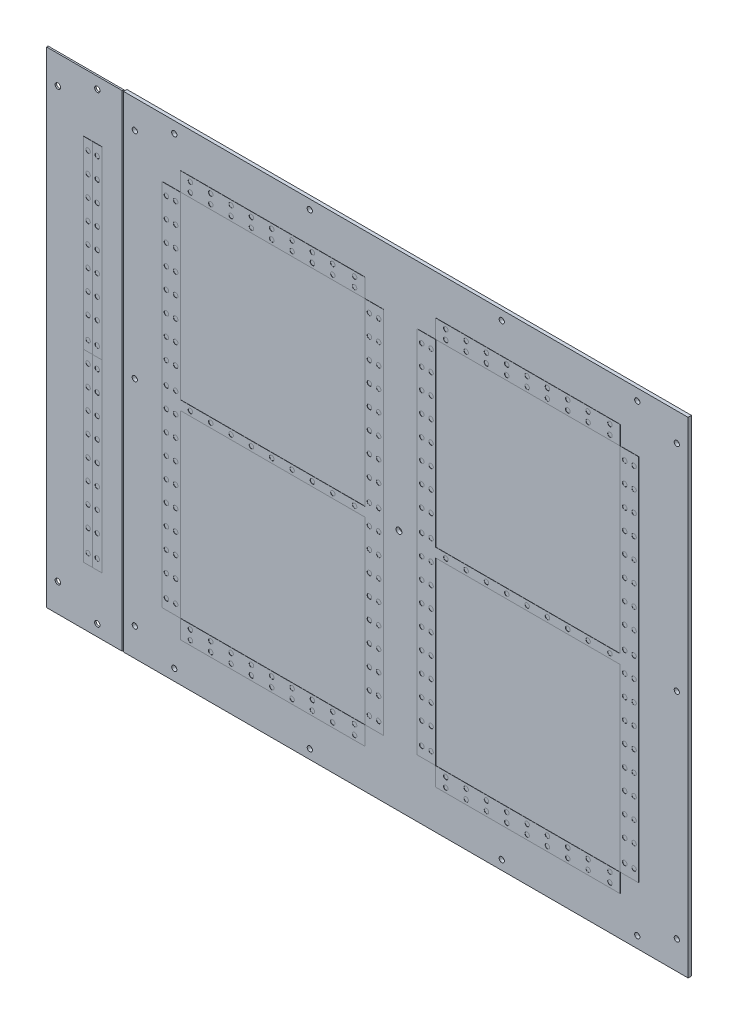
from build123d import *

# Parameters (mm, degrees)
ESBO_O4_W                        = 500
ESBO_O4_H                        = 430
FLANGE_BASE1_DEPTH               = 3
ESBO_O6_W                        = 67
ESBO_O6_H                        = 430
FLANGE_BASE2_DEPTH               = 1.4
ESBO_O9_R                        = 2.4
CORTE_EXTRUS_O2_DEPTH            = 10
RESSALTO_EXTRUS_O1_OUTLINE_W     = 8.2
RESSALTO_EXTRUS_O1_OUTLINE_H     = 163.357552272
RESSALTO_EXTRUS_O1_OUTLINE_R     = 2
RESSALTO_EXTRUS_O1_DEPTH         = 0.2
RESSALTO_EXTRUS_O1_2_OUTLINE_W   = 8.2
RESSALTO_EXTRUS_O1_2_OUTLINE_H   = 163.357552271
RESSALTO_EXTRUS_O1_2_OUTLINE_R   = 2
RESSALTO_EXTRUS_O1_2_DEPTH       = 0.2
RESSALTO_EXTRUS_O1_3_OUTLINE_W   = 8.2
RESSALTO_EXTRUS_O1_3_OUTLINE_H   = 163.357552271
RESSALTO_EXTRUS_O1_3_OUTLINE_R   = 2
RESSALTO_EXTRUS_O1_3_DEPTH       = 0.2
RESSALTO_EXTRUS_O1_4_OUTLINE_W   = 8.2
RESSALTO_EXTRUS_O1_4_OUTLINE_H   = 163.357552272
RESSALTO_EXTRUS_O1_4_OUTLINE_R   = 2
RESSALTO_EXTRUS_O1_4_DEPTH       = 0.2
RESSALTO_EXTRUS_O1_5_OUTLINE_W   = 163.357552272
RESSALTO_EXTRUS_O1_5_OUTLINE_H   = 16.4
RESSALTO_EXTRUS_O1_5_OUTLINE_R   = 2
RESSALTO_EXTRUS_O1_5_OUTLINE_W_2 = 163.357552271
RESSALTO_EXTRUS_O1_5_DEPTH       = 0.2
ESBO_O5_R                        = 2.714887618
ESBO_O5_R_2                      = 2.6
CORTE_EXTRUS_O1_DEPTH            = 10
ESBO_O13_R                       = 2.3
CORTE_EXTRUS_O3_DEPTH            = 3


with BuildPart() as part:
    # Flange-base1: sheet metal written as solids
    # Esboço4 → Flange-base1 (new body)
    with BuildSketch(Plane.XY):
        with Locations((39.157455037, 0)):
            Rectangle(ESBO_O4_W, ESBO_O4_H)
    extrude(amount=-FLANGE_BASE1_DEPTH)

    # Ressalto-extrus_o1 5 outline → Ressalto-extrus_o1 5 (add)
    # profile 1 of 6: a face of its own
    with BuildSketch(Plane.XY):
        with Locations((-78.655821477, -171.990181002)):
            Rectangle(RESSALTO_EXTRUS_O1_5_OUTLINE_W, RESSALTO_EXTRUS_O1_5_OUTLINE_H)
        with Locations((-151.334597613, -176.090181002)):
            Circle(RESSALTO_EXTRUS_O1_5_OUTLINE_R, mode=Mode.SUBTRACT)
        with Locations((-151.334597613, -167.890181002)):
            Circle(RESSALTO_EXTRUS_O1_5_OUTLINE_R, mode=Mode.SUBTRACT)
        with Locations((-133.334597613, -176.090181002)):
            Circle(RESSALTO_EXTRUS_O1_5_OUTLINE_R, mode=Mode.SUBTRACT)
        with Locations((-133.334597613, -167.890181002)):
            Circle(RESSALTO_EXTRUS_O1_5_OUTLINE_R, mode=Mode.SUBTRACT)
        with Locations((-115.334597613, -176.090181002)):
            Circle(RESSALTO_EXTRUS_O1_5_OUTLINE_R, mode=Mode.SUBTRACT)
        with Locations((-115.334597613, -167.890181002)):
            Circle(RESSALTO_EXTRUS_O1_5_OUTLINE_R, mode=Mode.SUBTRACT)
        with Locations((-97.334597613, -176.090181002)):
            Circle(RESSALTO_EXTRUS_O1_5_OUTLINE_R, mode=Mode.SUBTRACT)
        with Locations((-79.334597613, -176.090181002)):
            Circle(RESSALTO_EXTRUS_O1_5_OUTLINE_R, mode=Mode.SUBTRACT)
        with Locations((-97.334597613, -167.890181002)):
            Circle(RESSALTO_EXTRUS_O1_5_OUTLINE_R, mode=Mode.SUBTRACT)
        with Locations((-79.334597613, -167.890181002)):
            Circle(RESSALTO_EXTRUS_O1_5_OUTLINE_R, mode=Mode.SUBTRACT)
        with Locations((-61.334597613, -176.090181002)):
            Circle(RESSALTO_EXTRUS_O1_5_OUTLINE_R, mode=Mode.SUBTRACT)
        with Locations((-61.334597613, -167.890181002)):
            Circle(RESSALTO_EXTRUS_O1_5_OUTLINE_R, mode=Mode.SUBTRACT)
        with Locations((-43.334597613, -176.090181002)):
            Circle(RESSALTO_EXTRUS_O1_5_OUTLINE_R, mode=Mode.SUBTRACT)
        with Locations((-25.334597613, -176.090181002)):
            Circle(RESSALTO_EXTRUS_O1_5_OUTLINE_R, mode=Mode.SUBTRACT)
        with Locations((-43.334597613, -167.890181002)):
            Circle(RESSALTO_EXTRUS_O1_5_OUTLINE_R, mode=Mode.SUBTRACT)
        with Locations((-25.334597613, -167.890181002)):
            Circle(RESSALTO_EXTRUS_O1_5_OUTLINE_R, mode=Mode.SUBTRACT)
        with Locations((-5.977045341, -176.090181002)):
            Circle(RESSALTO_EXTRUS_O1_5_OUTLINE_R, mode=Mode.SUBTRACT)
        with Locations((-5.977045341, -167.890181002)):
            Circle(RESSALTO_EXTRUS_O1_5_OUTLINE_R, mode=Mode.SUBTRACT)
    # profile 2 of 6: a face of its own
    with BuildSketch(Plane.XY):
        with Locations((147.501730795, -171.990181002)):
            Rectangle(RESSALTO_EXTRUS_O1_5_OUTLINE_W_2, RESSALTO_EXTRUS_O1_5_OUTLINE_H)
        with Locations((74.822954659, -176.090181002)):
            Circle(RESSALTO_EXTRUS_O1_5_OUTLINE_R, mode=Mode.SUBTRACT)
        with Locations((74.822954659, -167.890181002)):
            Circle(RESSALTO_EXTRUS_O1_5_OUTLINE_R, mode=Mode.SUBTRACT)
        with Locations((92.822954659, -176.090181002)):
            Circle(RESSALTO_EXTRUS_O1_5_OUTLINE_R, mode=Mode.SUBTRACT)
        with Locations((110.822954659, -176.090181002)):
            Circle(RESSALTO_EXTRUS_O1_5_OUTLINE_R, mode=Mode.SUBTRACT)
        with Locations((92.822954659, -167.890181002)):
            Circle(RESSALTO_EXTRUS_O1_5_OUTLINE_R, mode=Mode.SUBTRACT)
        with Locations((110.822954659, -167.890181002)):
            Circle(RESSALTO_EXTRUS_O1_5_OUTLINE_R, mode=Mode.SUBTRACT)
        with Locations((128.822954659, -176.090181002)):
            Circle(RESSALTO_EXTRUS_O1_5_OUTLINE_R, mode=Mode.SUBTRACT)
        with Locations((128.822954659, -167.890181002)):
            Circle(RESSALTO_EXTRUS_O1_5_OUTLINE_R, mode=Mode.SUBTRACT)
        with Locations((146.822954659, -176.090181002)):
            Circle(RESSALTO_EXTRUS_O1_5_OUTLINE_R, mode=Mode.SUBTRACT)
        with Locations((164.822954659, -176.090181002)):
            Circle(RESSALTO_EXTRUS_O1_5_OUTLINE_R, mode=Mode.SUBTRACT)
        with Locations((146.822954659, -167.890181002)):
            Circle(RESSALTO_EXTRUS_O1_5_OUTLINE_R, mode=Mode.SUBTRACT)
        with Locations((164.822954659, -167.890181002)):
            Circle(RESSALTO_EXTRUS_O1_5_OUTLINE_R, mode=Mode.SUBTRACT)
        with Locations((182.822954659, -176.090181002)):
            Circle(RESSALTO_EXTRUS_O1_5_OUTLINE_R, mode=Mode.SUBTRACT)
        with Locations((182.822954659, -167.890181002)):
            Circle(RESSALTO_EXTRUS_O1_5_OUTLINE_R, mode=Mode.SUBTRACT)
        with Locations((200.822954659, -176.090181002)):
            Circle(RESSALTO_EXTRUS_O1_5_OUTLINE_R, mode=Mode.SUBTRACT)
        with Locations((200.822954659, -167.890181002)):
            Circle(RESSALTO_EXTRUS_O1_5_OUTLINE_R, mode=Mode.SUBTRACT)
        with Locations((220.18050693, -176.090181002)):
            Circle(RESSALTO_EXTRUS_O1_5_OUTLINE_R, mode=Mode.SUBTRACT)
        with Locations((220.18050693, -167.890181002)):
            Circle(RESSALTO_EXTRUS_O1_5_OUTLINE_R, mode=Mode.SUBTRACT)
    # profile 3 of 6: a face of its own
    with BuildSketch(Plane.XY):
        Polygon((3.022954659, 3.787927443), (-160.334597613, 3.787927443), (-160.334597613, 163.045479714), (-176.734597613, 163.045479714), (-176.734597613, -163.669624829), (-160.334597613, -163.669624829), (-160.334597613, -4.412072557), (3.022954659, -4.412072557), (3.022954659, -163.669624829), (19.422954659, -163.669624829), (19.422954659, 163.045479714), (3.022954659, 163.045479714), align=None)
        with Locations((-172.634597613, -154.669624829)):
            Circle(RESSALTO_EXTRUS_O1_5_OUTLINE_R, mode=Mode.SUBTRACT)
        with Locations((-164.434597613, -154.669624829)):
            Circle(RESSALTO_EXTRUS_O1_5_OUTLINE_R, mode=Mode.SUBTRACT)
        with Locations((-172.634597613, -135.312072557)):
            Circle(RESSALTO_EXTRUS_O1_5_OUTLINE_R, mode=Mode.SUBTRACT)
        with Locations((-164.434597613, -135.312072557)):
            Circle(RESSALTO_EXTRUS_O1_5_OUTLINE_R, mode=Mode.SUBTRACT)
        with Locations((-172.634597613, -117.312072557)):
            Circle(RESSALTO_EXTRUS_O1_5_OUTLINE_R, mode=Mode.SUBTRACT)
        with Locations((-164.434597613, -117.312072557)):
            Circle(RESSALTO_EXTRUS_O1_5_OUTLINE_R, mode=Mode.SUBTRACT)
        with Locations((-172.634597613, -99.312072557)):
            Circle(RESSALTO_EXTRUS_O1_5_OUTLINE_R, mode=Mode.SUBTRACT)
        with Locations((-164.434597613, -99.312072557)):
            Circle(RESSALTO_EXTRUS_O1_5_OUTLINE_R, mode=Mode.SUBTRACT)
        with Locations((7.122954659, -154.669624829)):
            Circle(RESSALTO_EXTRUS_O1_5_OUTLINE_R, mode=Mode.SUBTRACT)
        with Locations((7.122954659, -135.312072557)):
            Circle(RESSALTO_EXTRUS_O1_5_OUTLINE_R, mode=Mode.SUBTRACT)
        with Locations((15.322954659, -154.669624829)):
            Circle(RESSALTO_EXTRUS_O1_5_OUTLINE_R, mode=Mode.SUBTRACT)
        with Locations((15.322954659, -135.312072557)):
            Circle(RESSALTO_EXTRUS_O1_5_OUTLINE_R, mode=Mode.SUBTRACT)
        with Locations((7.122954659, -117.312072557)):
            Circle(RESSALTO_EXTRUS_O1_5_OUTLINE_R, mode=Mode.SUBTRACT)
        with Locations((15.322954659, -117.312072557)):
            Circle(RESSALTO_EXTRUS_O1_5_OUTLINE_R, mode=Mode.SUBTRACT)
        with Locations((7.122954659, -99.312072557)):
            Circle(RESSALTO_EXTRUS_O1_5_OUTLINE_R, mode=Mode.SUBTRACT)
        with Locations((15.322954659, -99.312072557)):
            Circle(RESSALTO_EXTRUS_O1_5_OUTLINE_R, mode=Mode.SUBTRACT)
        with Locations((-172.634597613, -81.312072557)):
            Circle(RESSALTO_EXTRUS_O1_5_OUTLINE_R, mode=Mode.SUBTRACT)
        with Locations((-164.434597613, -81.312072557)):
            Circle(RESSALTO_EXTRUS_O1_5_OUTLINE_R, mode=Mode.SUBTRACT)
        with Locations((-172.634597613, -63.312072557)):
            Circle(RESSALTO_EXTRUS_O1_5_OUTLINE_R, mode=Mode.SUBTRACT)
        with Locations((-164.434597613, -63.312072557)):
            Circle(RESSALTO_EXTRUS_O1_5_OUTLINE_R, mode=Mode.SUBTRACT)
        with Locations((-172.634597613, -45.312072557)):
            Circle(RESSALTO_EXTRUS_O1_5_OUTLINE_R, mode=Mode.SUBTRACT)
        with Locations((-164.434597613, -45.312072557)):
            Circle(RESSALTO_EXTRUS_O1_5_OUTLINE_R, mode=Mode.SUBTRACT)
        with Locations((-172.634597613, -27.312072557)):
            Circle(RESSALTO_EXTRUS_O1_5_OUTLINE_R, mode=Mode.SUBTRACT)
        with Locations((-164.434597613, -27.312072557)):
            Circle(RESSALTO_EXTRUS_O1_5_OUTLINE_R, mode=Mode.SUBTRACT)
        with Locations((-172.634597613, -9.312072557)):
            Circle(RESSALTO_EXTRUS_O1_5_OUTLINE_R, mode=Mode.SUBTRACT)
        with Locations((-164.434597613, -9.312072557)):
            Circle(RESSALTO_EXTRUS_O1_5_OUTLINE_R, mode=Mode.SUBTRACT)
        with Locations((-151.334597613, -0.312072557)):
            Circle(RESSALTO_EXTRUS_O1_5_OUTLINE_R, mode=Mode.SUBTRACT)
        with Locations((-133.334597613, -0.312072557)):
            Circle(RESSALTO_EXTRUS_O1_5_OUTLINE_R, mode=Mode.SUBTRACT)
        with Locations((-115.334597613, -0.312072557)):
            Circle(RESSALTO_EXTRUS_O1_5_OUTLINE_R, mode=Mode.SUBTRACT)
        with Locations((-97.334597613, -0.312072557)):
            Circle(RESSALTO_EXTRUS_O1_5_OUTLINE_R, mode=Mode.SUBTRACT)
        with Locations((-79.334597613, -0.312072557)):
            Circle(RESSALTO_EXTRUS_O1_5_OUTLINE_R, mode=Mode.SUBTRACT)
        with Locations((7.122954659, -81.312072557)):
            Circle(RESSALTO_EXTRUS_O1_5_OUTLINE_R, mode=Mode.SUBTRACT)
        with Locations((15.322954659, -81.312072557)):
            Circle(RESSALTO_EXTRUS_O1_5_OUTLINE_R, mode=Mode.SUBTRACT)
        with Locations((7.122954659, -63.312072557)):
            Circle(RESSALTO_EXTRUS_O1_5_OUTLINE_R, mode=Mode.SUBTRACT)
        with Locations((7.122954659, -45.312072557)):
            Circle(RESSALTO_EXTRUS_O1_5_OUTLINE_R, mode=Mode.SUBTRACT)
        with Locations((15.322954659, -63.312072557)):
            Circle(RESSALTO_EXTRUS_O1_5_OUTLINE_R, mode=Mode.SUBTRACT)
        with Locations((15.322954659, -45.312072557)):
            Circle(RESSALTO_EXTRUS_O1_5_OUTLINE_R, mode=Mode.SUBTRACT)
        with Locations((-61.334597613, -0.312072557)):
            Circle(RESSALTO_EXTRUS_O1_5_OUTLINE_R, mode=Mode.SUBTRACT)
        with Locations((-43.334597613, -0.312072557)):
            Circle(RESSALTO_EXTRUS_O1_5_OUTLINE_R, mode=Mode.SUBTRACT)
        with Locations((-25.334597613, -0.312072557)):
            Circle(RESSALTO_EXTRUS_O1_5_OUTLINE_R, mode=Mode.SUBTRACT)
        with Locations((7.122954659, -27.312072557)):
            Circle(RESSALTO_EXTRUS_O1_5_OUTLINE_R, mode=Mode.SUBTRACT)
        with Locations((15.322954659, -27.312072557)):
            Circle(RESSALTO_EXTRUS_O1_5_OUTLINE_R, mode=Mode.SUBTRACT)
        with Locations((-5.977045341, -0.312072557)):
            Circle(RESSALTO_EXTRUS_O1_5_OUTLINE_R, mode=Mode.SUBTRACT)
        with Locations((7.122954659, -9.312072557)):
            Circle(RESSALTO_EXTRUS_O1_5_OUTLINE_R, mode=Mode.SUBTRACT)
        with Locations((15.322954659, -9.312072557)):
            Circle(RESSALTO_EXTRUS_O1_5_OUTLINE_R, mode=Mode.SUBTRACT)
        with Locations((-172.634597613, 8.687927443)):
            Circle(RESSALTO_EXTRUS_O1_5_OUTLINE_R, mode=Mode.SUBTRACT)
        with Locations((-164.434597613, 8.687927443)):
            Circle(RESSALTO_EXTRUS_O1_5_OUTLINE_R, mode=Mode.SUBTRACT)
        with Locations((-172.634597613, 28.045479714)):
            Circle(RESSALTO_EXTRUS_O1_5_OUTLINE_R, mode=Mode.SUBTRACT)
        with Locations((-164.434597613, 28.045479714)):
            Circle(RESSALTO_EXTRUS_O1_5_OUTLINE_R, mode=Mode.SUBTRACT)
        with Locations((-172.634597613, 46.045479714)):
            Circle(RESSALTO_EXTRUS_O1_5_OUTLINE_R, mode=Mode.SUBTRACT)
        with Locations((-164.434597613, 46.045479714)):
            Circle(RESSALTO_EXTRUS_O1_5_OUTLINE_R, mode=Mode.SUBTRACT)
        with Locations((-172.634597613, 64.045479714)):
            Circle(RESSALTO_EXTRUS_O1_5_OUTLINE_R, mode=Mode.SUBTRACT)
        with Locations((-164.434597613, 64.045479714)):
            Circle(RESSALTO_EXTRUS_O1_5_OUTLINE_R, mode=Mode.SUBTRACT)
        with Locations((-172.634597613, 82.045479714)):
            Circle(RESSALTO_EXTRUS_O1_5_OUTLINE_R, mode=Mode.SUBTRACT)
        with Locations((-164.434597613, 82.045479714)):
            Circle(RESSALTO_EXTRUS_O1_5_OUTLINE_R, mode=Mode.SUBTRACT)
        with Locations((7.122954659, 8.687927443)):
            Circle(RESSALTO_EXTRUS_O1_5_OUTLINE_R, mode=Mode.SUBTRACT)
        with Locations((15.322954659, 8.687927443)):
            Circle(RESSALTO_EXTRUS_O1_5_OUTLINE_R, mode=Mode.SUBTRACT)
        with Locations((7.122954659, 28.045479714)):
            Circle(RESSALTO_EXTRUS_O1_5_OUTLINE_R, mode=Mode.SUBTRACT)
        with Locations((15.322954659, 28.045479714)):
            Circle(RESSALTO_EXTRUS_O1_5_OUTLINE_R, mode=Mode.SUBTRACT)
        with Locations((7.122954659, 46.045479714)):
            Circle(RESSALTO_EXTRUS_O1_5_OUTLINE_R, mode=Mode.SUBTRACT)
        with Locations((7.122954659, 64.045479714)):
            Circle(RESSALTO_EXTRUS_O1_5_OUTLINE_R, mode=Mode.SUBTRACT)
        with Locations((15.322954659, 46.045479714)):
            Circle(RESSALTO_EXTRUS_O1_5_OUTLINE_R, mode=Mode.SUBTRACT)
        with Locations((15.322954659, 64.045479714)):
            Circle(RESSALTO_EXTRUS_O1_5_OUTLINE_R, mode=Mode.SUBTRACT)
        with Locations((7.122954659, 82.045479714)):
            Circle(RESSALTO_EXTRUS_O1_5_OUTLINE_R, mode=Mode.SUBTRACT)
        with Locations((15.322954659, 82.045479714)):
            Circle(RESSALTO_EXTRUS_O1_5_OUTLINE_R, mode=Mode.SUBTRACT)
        with Locations((-172.634597613, 100.045479714)):
            Circle(RESSALTO_EXTRUS_O1_5_OUTLINE_R, mode=Mode.SUBTRACT)
        with Locations((-164.434597613, 100.045479714)):
            Circle(RESSALTO_EXTRUS_O1_5_OUTLINE_R, mode=Mode.SUBTRACT)
        with Locations((-172.634597613, 118.045479714)):
            Circle(RESSALTO_EXTRUS_O1_5_OUTLINE_R, mode=Mode.SUBTRACT)
        with Locations((-164.434597613, 118.045479714)):
            Circle(RESSALTO_EXTRUS_O1_5_OUTLINE_R, mode=Mode.SUBTRACT)
        with Locations((-172.634597613, 136.045479714)):
            Circle(RESSALTO_EXTRUS_O1_5_OUTLINE_R, mode=Mode.SUBTRACT)
        with Locations((-164.434597613, 136.045479714)):
            Circle(RESSALTO_EXTRUS_O1_5_OUTLINE_R, mode=Mode.SUBTRACT)
        with Locations((-172.634597613, 154.045479714)):
            Circle(RESSALTO_EXTRUS_O1_5_OUTLINE_R, mode=Mode.SUBTRACT)
        with Locations((-164.434597613, 154.045479714)):
            Circle(RESSALTO_EXTRUS_O1_5_OUTLINE_R, mode=Mode.SUBTRACT)
        with Locations((7.122954659, 100.045479714)):
            Circle(RESSALTO_EXTRUS_O1_5_OUTLINE_R, mode=Mode.SUBTRACT)
        with Locations((15.322954659, 100.045479714)):
            Circle(RESSALTO_EXTRUS_O1_5_OUTLINE_R, mode=Mode.SUBTRACT)
        with Locations((7.122954659, 118.045479714)):
            Circle(RESSALTO_EXTRUS_O1_5_OUTLINE_R, mode=Mode.SUBTRACT)
        with Locations((15.322954659, 118.045479714)):
            Circle(RESSALTO_EXTRUS_O1_5_OUTLINE_R, mode=Mode.SUBTRACT)
        with Locations((7.122954659, 136.045479714)):
            Circle(RESSALTO_EXTRUS_O1_5_OUTLINE_R, mode=Mode.SUBTRACT)
        with Locations((7.122954659, 154.045479714)):
            Circle(RESSALTO_EXTRUS_O1_5_OUTLINE_R, mode=Mode.SUBTRACT)
        with Locations((15.322954659, 136.045479714)):
            Circle(RESSALTO_EXTRUS_O1_5_OUTLINE_R, mode=Mode.SUBTRACT)
        with Locations((15.322954659, 154.045479714)):
            Circle(RESSALTO_EXTRUS_O1_5_OUTLINE_R, mode=Mode.SUBTRACT)
    # profile 4 of 6: a face of its own
    with BuildSketch(Plane.XY):
        Polygon((229.18050693, 3.787927443), (65.822954659, 3.787927443), (65.822954659, 163.045479714), (49.422954659, 163.045479714), (49.422954659, -163.669624829), (65.822954659, -163.669624829), (65.822954659, -4.412072557), (229.18050693, -4.412072557), (229.18050693, -163.669624829), (245.58050693, -163.669624829), (245.58050693, 163.045479714), (229.18050693, 163.045479714), align=None)
        with Locations((53.522954659, -154.669624829)):
            Circle(RESSALTO_EXTRUS_O1_5_OUTLINE_R, mode=Mode.SUBTRACT)
        with Locations((53.522954659, -135.312072557)):
            Circle(RESSALTO_EXTRUS_O1_5_OUTLINE_R, mode=Mode.SUBTRACT)
        with Locations((61.722954659, -154.669624829)):
            Circle(RESSALTO_EXTRUS_O1_5_OUTLINE_R, mode=Mode.SUBTRACT)
        with Locations((61.722954659, -135.312072557)):
            Circle(RESSALTO_EXTRUS_O1_5_OUTLINE_R, mode=Mode.SUBTRACT)
        with Locations((53.522954659, -117.312072557)):
            Circle(RESSALTO_EXTRUS_O1_5_OUTLINE_R, mode=Mode.SUBTRACT)
        with Locations((61.722954659, -117.312072557)):
            Circle(RESSALTO_EXTRUS_O1_5_OUTLINE_R, mode=Mode.SUBTRACT)
        with Locations((53.522954659, -99.312072557)):
            Circle(RESSALTO_EXTRUS_O1_5_OUTLINE_R, mode=Mode.SUBTRACT)
        with Locations((61.722954659, -99.312072557)):
            Circle(RESSALTO_EXTRUS_O1_5_OUTLINE_R, mode=Mode.SUBTRACT)
        with Locations((233.28050693, -154.669624829)):
            Circle(RESSALTO_EXTRUS_O1_5_OUTLINE_R, mode=Mode.SUBTRACT)
        with Locations((241.48050693, -154.669624829)):
            Circle(RESSALTO_EXTRUS_O1_5_OUTLINE_R, mode=Mode.SUBTRACT)
        with Locations((233.28050693, -135.312072557)):
            Circle(RESSALTO_EXTRUS_O1_5_OUTLINE_R, mode=Mode.SUBTRACT)
        with Locations((241.48050693, -135.312072557)):
            Circle(RESSALTO_EXTRUS_O1_5_OUTLINE_R, mode=Mode.SUBTRACT)
        with Locations((233.28050693, -117.312072557)):
            Circle(RESSALTO_EXTRUS_O1_5_OUTLINE_R, mode=Mode.SUBTRACT)
        with Locations((241.48050693, -117.312072557)):
            Circle(RESSALTO_EXTRUS_O1_5_OUTLINE_R, mode=Mode.SUBTRACT)
        with Locations((233.28050693, -99.312072557)):
            Circle(RESSALTO_EXTRUS_O1_5_OUTLINE_R, mode=Mode.SUBTRACT)
        with Locations((241.48050693, -99.312072557)):
            Circle(RESSALTO_EXTRUS_O1_5_OUTLINE_R, mode=Mode.SUBTRACT)
        with Locations((53.522954659, -81.312072557)):
            Circle(RESSALTO_EXTRUS_O1_5_OUTLINE_R, mode=Mode.SUBTRACT)
        with Locations((61.722954659, -81.312072557)):
            Circle(RESSALTO_EXTRUS_O1_5_OUTLINE_R, mode=Mode.SUBTRACT)
        with Locations((53.522954659, -63.312072557)):
            Circle(RESSALTO_EXTRUS_O1_5_OUTLINE_R, mode=Mode.SUBTRACT)
        with Locations((53.522954659, -45.312072557)):
            Circle(RESSALTO_EXTRUS_O1_5_OUTLINE_R, mode=Mode.SUBTRACT)
        with Locations((61.722954659, -63.312072557)):
            Circle(RESSALTO_EXTRUS_O1_5_OUTLINE_R, mode=Mode.SUBTRACT)
        with Locations((61.722954659, -45.312072557)):
            Circle(RESSALTO_EXTRUS_O1_5_OUTLINE_R, mode=Mode.SUBTRACT)
        with Locations((53.522954659, -27.312072557)):
            Circle(RESSALTO_EXTRUS_O1_5_OUTLINE_R, mode=Mode.SUBTRACT)
        with Locations((61.722954659, -27.312072557)):
            Circle(RESSALTO_EXTRUS_O1_5_OUTLINE_R, mode=Mode.SUBTRACT)
        with Locations((53.522954659, -9.312072557)):
            Circle(RESSALTO_EXTRUS_O1_5_OUTLINE_R, mode=Mode.SUBTRACT)
        with Locations((61.722954659, -9.312072557)):
            Circle(RESSALTO_EXTRUS_O1_5_OUTLINE_R, mode=Mode.SUBTRACT)
        with Locations((74.822954659, -0.312072557)):
            Circle(RESSALTO_EXTRUS_O1_5_OUTLINE_R, mode=Mode.SUBTRACT)
        with Locations((92.822954659, -0.312072557)):
            Circle(RESSALTO_EXTRUS_O1_5_OUTLINE_R, mode=Mode.SUBTRACT)
        with Locations((110.822954659, -0.312072557)):
            Circle(RESSALTO_EXTRUS_O1_5_OUTLINE_R, mode=Mode.SUBTRACT)
        with Locations((128.822954659, -0.312072557)):
            Circle(RESSALTO_EXTRUS_O1_5_OUTLINE_R, mode=Mode.SUBTRACT)
        with Locations((233.28050693, -81.312072557)):
            Circle(RESSALTO_EXTRUS_O1_5_OUTLINE_R, mode=Mode.SUBTRACT)
        with Locations((241.48050693, -81.312072557)):
            Circle(RESSALTO_EXTRUS_O1_5_OUTLINE_R, mode=Mode.SUBTRACT)
        with Locations((233.28050693, -63.312072557)):
            Circle(RESSALTO_EXTRUS_O1_5_OUTLINE_R, mode=Mode.SUBTRACT)
        with Locations((241.48050693, -63.312072557)):
            Circle(RESSALTO_EXTRUS_O1_5_OUTLINE_R, mode=Mode.SUBTRACT)
        with Locations((233.28050693, -45.312072557)):
            Circle(RESSALTO_EXTRUS_O1_5_OUTLINE_R, mode=Mode.SUBTRACT)
        with Locations((241.48050693, -45.312072557)):
            Circle(RESSALTO_EXTRUS_O1_5_OUTLINE_R, mode=Mode.SUBTRACT)
        with Locations((146.822954659, -0.312072557)):
            Circle(RESSALTO_EXTRUS_O1_5_OUTLINE_R, mode=Mode.SUBTRACT)
        with Locations((164.822954659, -0.312072557)):
            Circle(RESSALTO_EXTRUS_O1_5_OUTLINE_R, mode=Mode.SUBTRACT)
        with Locations((182.822954659, -0.312072557)):
            Circle(RESSALTO_EXTRUS_O1_5_OUTLINE_R, mode=Mode.SUBTRACT)
        with Locations((233.28050693, -27.312072557)):
            Circle(RESSALTO_EXTRUS_O1_5_OUTLINE_R, mode=Mode.SUBTRACT)
        with Locations((241.48050693, -27.312072557)):
            Circle(RESSALTO_EXTRUS_O1_5_OUTLINE_R, mode=Mode.SUBTRACT)
        with Locations((200.822954659, -0.312072557)):
            Circle(RESSALTO_EXTRUS_O1_5_OUTLINE_R, mode=Mode.SUBTRACT)
        with Locations((220.18050693, -0.312072557)):
            Circle(RESSALTO_EXTRUS_O1_5_OUTLINE_R, mode=Mode.SUBTRACT)
        with Locations((233.28050693, -9.312072557)):
            Circle(RESSALTO_EXTRUS_O1_5_OUTLINE_R, mode=Mode.SUBTRACT)
        with Locations((241.48050693, -9.312072557)):
            Circle(RESSALTO_EXTRUS_O1_5_OUTLINE_R, mode=Mode.SUBTRACT)
        with Locations((53.522954659, 8.687927443)):
            Circle(RESSALTO_EXTRUS_O1_5_OUTLINE_R, mode=Mode.SUBTRACT)
        with Locations((61.722954659, 8.687927443)):
            Circle(RESSALTO_EXTRUS_O1_5_OUTLINE_R, mode=Mode.SUBTRACT)
        with Locations((53.522954659, 28.045479714)):
            Circle(RESSALTO_EXTRUS_O1_5_OUTLINE_R, mode=Mode.SUBTRACT)
        with Locations((61.722954659, 28.045479714)):
            Circle(RESSALTO_EXTRUS_O1_5_OUTLINE_R, mode=Mode.SUBTRACT)
        with Locations((53.522954659, 46.045479714)):
            Circle(RESSALTO_EXTRUS_O1_5_OUTLINE_R, mode=Mode.SUBTRACT)
        with Locations((53.522954659, 64.045479714)):
            Circle(RESSALTO_EXTRUS_O1_5_OUTLINE_R, mode=Mode.SUBTRACT)
        with Locations((61.722954659, 46.045479714)):
            Circle(RESSALTO_EXTRUS_O1_5_OUTLINE_R, mode=Mode.SUBTRACT)
        with Locations((61.722954659, 64.045479714)):
            Circle(RESSALTO_EXTRUS_O1_5_OUTLINE_R, mode=Mode.SUBTRACT)
        with Locations((53.522954659, 82.045479714)):
            Circle(RESSALTO_EXTRUS_O1_5_OUTLINE_R, mode=Mode.SUBTRACT)
        with Locations((61.722954659, 82.045479714)):
            Circle(RESSALTO_EXTRUS_O1_5_OUTLINE_R, mode=Mode.SUBTRACT)
        with Locations((233.28050693, 8.687927443)):
            Circle(RESSALTO_EXTRUS_O1_5_OUTLINE_R, mode=Mode.SUBTRACT)
        with Locations((241.48050693, 8.687927443)):
            Circle(RESSALTO_EXTRUS_O1_5_OUTLINE_R, mode=Mode.SUBTRACT)
        with Locations((233.28050693, 28.045479714)):
            Circle(RESSALTO_EXTRUS_O1_5_OUTLINE_R, mode=Mode.SUBTRACT)
        with Locations((241.48050693, 28.045479714)):
            Circle(RESSALTO_EXTRUS_O1_5_OUTLINE_R, mode=Mode.SUBTRACT)
        with Locations((233.28050693, 46.045479714)):
            Circle(RESSALTO_EXTRUS_O1_5_OUTLINE_R, mode=Mode.SUBTRACT)
        with Locations((241.48050693, 46.045479714)):
            Circle(RESSALTO_EXTRUS_O1_5_OUTLINE_R, mode=Mode.SUBTRACT)
        with Locations((233.28050693, 64.045479714)):
            Circle(RESSALTO_EXTRUS_O1_5_OUTLINE_R, mode=Mode.SUBTRACT)
        with Locations((241.48050693, 64.045479714)):
            Circle(RESSALTO_EXTRUS_O1_5_OUTLINE_R, mode=Mode.SUBTRACT)
        with Locations((233.28050693, 82.045479714)):
            Circle(RESSALTO_EXTRUS_O1_5_OUTLINE_R, mode=Mode.SUBTRACT)
        with Locations((241.48050693, 82.045479714)):
            Circle(RESSALTO_EXTRUS_O1_5_OUTLINE_R, mode=Mode.SUBTRACT)
        with Locations((53.522954659, 100.045479714)):
            Circle(RESSALTO_EXTRUS_O1_5_OUTLINE_R, mode=Mode.SUBTRACT)
        with Locations((61.722954659, 100.045479714)):
            Circle(RESSALTO_EXTRUS_O1_5_OUTLINE_R, mode=Mode.SUBTRACT)
        with Locations((53.522954659, 118.045479714)):
            Circle(RESSALTO_EXTRUS_O1_5_OUTLINE_R, mode=Mode.SUBTRACT)
        with Locations((61.722954659, 118.045479714)):
            Circle(RESSALTO_EXTRUS_O1_5_OUTLINE_R, mode=Mode.SUBTRACT)
        with Locations((53.522954659, 136.045479714)):
            Circle(RESSALTO_EXTRUS_O1_5_OUTLINE_R, mode=Mode.SUBTRACT)
        with Locations((53.522954659, 154.045479714)):
            Circle(RESSALTO_EXTRUS_O1_5_OUTLINE_R, mode=Mode.SUBTRACT)
        with Locations((61.722954659, 136.045479714)):
            Circle(RESSALTO_EXTRUS_O1_5_OUTLINE_R, mode=Mode.SUBTRACT)
        with Locations((61.722954659, 154.045479714)):
            Circle(RESSALTO_EXTRUS_O1_5_OUTLINE_R, mode=Mode.SUBTRACT)
        with Locations((233.28050693, 100.045479714)):
            Circle(RESSALTO_EXTRUS_O1_5_OUTLINE_R, mode=Mode.SUBTRACT)
        with Locations((241.48050693, 100.045479714)):
            Circle(RESSALTO_EXTRUS_O1_5_OUTLINE_R, mode=Mode.SUBTRACT)
        with Locations((233.28050693, 118.045479714)):
            Circle(RESSALTO_EXTRUS_O1_5_OUTLINE_R, mode=Mode.SUBTRACT)
        with Locations((241.48050693, 118.045479714)):
            Circle(RESSALTO_EXTRUS_O1_5_OUTLINE_R, mode=Mode.SUBTRACT)
        with Locations((233.28050693, 136.045479714)):
            Circle(RESSALTO_EXTRUS_O1_5_OUTLINE_R, mode=Mode.SUBTRACT)
        with Locations((241.48050693, 136.045479714)):
            Circle(RESSALTO_EXTRUS_O1_5_OUTLINE_R, mode=Mode.SUBTRACT)
        with Locations((233.28050693, 154.045479714)):
            Circle(RESSALTO_EXTRUS_O1_5_OUTLINE_R, mode=Mode.SUBTRACT)
        with Locations((241.48050693, 154.045479714)):
            Circle(RESSALTO_EXTRUS_O1_5_OUTLINE_R, mode=Mode.SUBTRACT)
    # profile 5 of 6: a face of its own
    with BuildSketch(Plane.XY):
        with Locations((-78.662362751, 171.378154522)):
            Rectangle(RESSALTO_EXTRUS_O1_5_OUTLINE_W_2, RESSALTO_EXTRUS_O1_5_OUTLINE_H)
        with Locations((-151.341138886, 167.278154522)):
            Circle(RESSALTO_EXTRUS_O1_5_OUTLINE_R, mode=Mode.SUBTRACT)
        with Locations((-151.341138886, 175.478154522)):
            Circle(RESSALTO_EXTRUS_O1_5_OUTLINE_R, mode=Mode.SUBTRACT)
        with Locations((-133.341138886, 167.278154522)):
            Circle(RESSALTO_EXTRUS_O1_5_OUTLINE_R, mode=Mode.SUBTRACT)
        with Locations((-133.341138886, 175.478154522)):
            Circle(RESSALTO_EXTRUS_O1_5_OUTLINE_R, mode=Mode.SUBTRACT)
        with Locations((-115.341138886, 167.278154522)):
            Circle(RESSALTO_EXTRUS_O1_5_OUTLINE_R, mode=Mode.SUBTRACT)
        with Locations((-115.341138886, 175.478154522)):
            Circle(RESSALTO_EXTRUS_O1_5_OUTLINE_R, mode=Mode.SUBTRACT)
        with Locations((-97.341138886, 167.278154522)):
            Circle(RESSALTO_EXTRUS_O1_5_OUTLINE_R, mode=Mode.SUBTRACT)
        with Locations((-79.341138886, 167.278154522)):
            Circle(RESSALTO_EXTRUS_O1_5_OUTLINE_R, mode=Mode.SUBTRACT)
        with Locations((-97.341138886, 175.478154522)):
            Circle(RESSALTO_EXTRUS_O1_5_OUTLINE_R, mode=Mode.SUBTRACT)
        with Locations((-79.341138886, 175.478154522)):
            Circle(RESSALTO_EXTRUS_O1_5_OUTLINE_R, mode=Mode.SUBTRACT)
        with Locations((-61.341138886, 167.278154522)):
            Circle(RESSALTO_EXTRUS_O1_5_OUTLINE_R, mode=Mode.SUBTRACT)
        with Locations((-61.341138886, 175.478154522)):
            Circle(RESSALTO_EXTRUS_O1_5_OUTLINE_R, mode=Mode.SUBTRACT)
        with Locations((-43.341138886, 167.278154522)):
            Circle(RESSALTO_EXTRUS_O1_5_OUTLINE_R, mode=Mode.SUBTRACT)
        with Locations((-25.341138886, 167.278154522)):
            Circle(RESSALTO_EXTRUS_O1_5_OUTLINE_R, mode=Mode.SUBTRACT)
        with Locations((-43.341138886, 175.478154522)):
            Circle(RESSALTO_EXTRUS_O1_5_OUTLINE_R, mode=Mode.SUBTRACT)
        with Locations((-25.341138886, 175.478154522)):
            Circle(RESSALTO_EXTRUS_O1_5_OUTLINE_R, mode=Mode.SUBTRACT)
        with Locations((-5.983586615, 167.278154522)):
            Circle(RESSALTO_EXTRUS_O1_5_OUTLINE_R, mode=Mode.SUBTRACT)
        with Locations((-5.983586615, 175.478154522)):
            Circle(RESSALTO_EXTRUS_O1_5_OUTLINE_R, mode=Mode.SUBTRACT)
    # profile 6 of 6: a face of its own
    with BuildSketch(Plane.XY):
        with Locations((147.495189521, 171.378154522)):
            Rectangle(RESSALTO_EXTRUS_O1_5_OUTLINE_W, RESSALTO_EXTRUS_O1_5_OUTLINE_H)
        with Locations((74.816413385, 167.278154522)):
            Circle(RESSALTO_EXTRUS_O1_5_OUTLINE_R, mode=Mode.SUBTRACT)
        with Locations((74.816413385, 175.478154522)):
            Circle(RESSALTO_EXTRUS_O1_5_OUTLINE_R, mode=Mode.SUBTRACT)
        with Locations((92.816413385, 167.278154522)):
            Circle(RESSALTO_EXTRUS_O1_5_OUTLINE_R, mode=Mode.SUBTRACT)
        with Locations((110.816413385, 167.278154522)):
            Circle(RESSALTO_EXTRUS_O1_5_OUTLINE_R, mode=Mode.SUBTRACT)
        with Locations((92.816413385, 175.478154522)):
            Circle(RESSALTO_EXTRUS_O1_5_OUTLINE_R, mode=Mode.SUBTRACT)
        with Locations((110.816413385, 175.478154522)):
            Circle(RESSALTO_EXTRUS_O1_5_OUTLINE_R, mode=Mode.SUBTRACT)
        with Locations((128.816413385, 167.278154522)):
            Circle(RESSALTO_EXTRUS_O1_5_OUTLINE_R, mode=Mode.SUBTRACT)
        with Locations((128.816413385, 175.478154522)):
            Circle(RESSALTO_EXTRUS_O1_5_OUTLINE_R, mode=Mode.SUBTRACT)
        with Locations((146.816413385, 167.278154522)):
            Circle(RESSALTO_EXTRUS_O1_5_OUTLINE_R, mode=Mode.SUBTRACT)
        with Locations((164.816413385, 167.278154522)):
            Circle(RESSALTO_EXTRUS_O1_5_OUTLINE_R, mode=Mode.SUBTRACT)
        with Locations((146.816413385, 175.478154522)):
            Circle(RESSALTO_EXTRUS_O1_5_OUTLINE_R, mode=Mode.SUBTRACT)
        with Locations((164.816413385, 175.478154522)):
            Circle(RESSALTO_EXTRUS_O1_5_OUTLINE_R, mode=Mode.SUBTRACT)
        with Locations((182.816413385, 167.278154522)):
            Circle(RESSALTO_EXTRUS_O1_5_OUTLINE_R, mode=Mode.SUBTRACT)
        with Locations((182.816413385, 175.478154522)):
            Circle(RESSALTO_EXTRUS_O1_5_OUTLINE_R, mode=Mode.SUBTRACT)
        with Locations((200.816413385, 167.278154522)):
            Circle(RESSALTO_EXTRUS_O1_5_OUTLINE_R, mode=Mode.SUBTRACT)
        with Locations((200.816413385, 175.478154522)):
            Circle(RESSALTO_EXTRUS_O1_5_OUTLINE_R, mode=Mode.SUBTRACT)
        with Locations((220.173965657, 167.278154522)):
            Circle(RESSALTO_EXTRUS_O1_5_OUTLINE_R, mode=Mode.SUBTRACT)
        with Locations((220.173965657, 175.478154522)):
            Circle(RESSALTO_EXTRUS_O1_5_OUTLINE_R, mode=Mode.SUBTRACT)
    extrude(amount=RESSALTO_EXTRUS_O1_5_DEPTH)

    # Esboço5 → Corte-extrusão1 (cut)
    with BuildSketch(Plane.XY):
        with Locations((262.706189469, 234.004308936)):
            Circle(ESBO_O5_R)
        with Locations((262.706189469, -233.093281996)):
            Circle(ESBO_O5_R_2)
        with Locations((-262.706189469, -233.093281996)):
            Circle(ESBO_O5_R_2)
        with Locations((-262.706189469, 234.004308936)):
            Circle(ESBO_O5_R)
        with Locations((33.081235093, 0)):
            Circle(ESBO_O5_R_2)
    extrude(amount=-CORTE_EXTRUS_O1_DEPTH, mode=Mode.SUBTRACT)

    # Esboço13 → Corte-extrusão3 (cut)
    with BuildSketch(Plane.XY):
        with Locations((-165.842544963, 205)):
            Circle(ESBO_O13_R)
        with Locations((-200.842544963, 190)):
            Circle(ESBO_O13_R)
        with Locations((-45.842544963, 206.691860023)):
            Circle(ESBO_O13_R)
        with Locations((-268.999342474, -0.312072557)):
            Circle(ESBO_O13_R)
        with Locations(Location((124.157455037, 206.691860023, 0), (0, 0, 180))):
            Circle(ESBO_O13_R)
        with Locations(Location((244.157455037, 205, 0), (0, 0, 180))):
            Circle(ESBO_O13_R)
        with Locations(Location((279.157455037, 190, 0), (0, 0, 180))):
            Circle(ESBO_O13_R)
        with Locations((279.157455037, -190)):
            Circle(ESBO_O13_R)
        with Locations((244.157455037, -205)):
            Circle(ESBO_O13_R)
        with Locations((124.157455037, -206.691860023)):
            Circle(ESBO_O13_R)
        with Locations(Location((-45.842544963, -206.691860023, 0), (0, 0, 180))):
            Circle(ESBO_O13_R)
        with Locations(Location((-200.842544963, -190, 0), (0, 0, 180))):
            Circle(ESBO_O13_R)
        with Locations(Location((-165.842544963, -205, 0), (0, 0, 180))):
            Circle(ESBO_O13_R)
        with Locations((240, 0)):
            Circle(ESBO_O13_R)
        with Locations((-200.842544963, -0.312072557)):
            Circle(ESBO_O13_R)
        with Locations((279.157455037, 0)):
            Circle(ESBO_O13_R)
    extrude(amount=-CORTE_EXTRUS_O3_DEPTH, mode=Mode.SUBTRACT)


with BuildPart() as body_2:
    # Flange-base2: sheet metal written as solids
    # Esboço6 → Flange-base2 (new body)
    with BuildSketch(Plane.XY):
        with Locations((-245.499342474, 0)):
            Rectangle(ESBO_O6_W, ESBO_O6_H)
    extrude(amount=-FLANGE_BASE2_DEPTH)

    # Esboço9 → Corte-extrusão2 (cut)
    with BuildSketch(Plane.XY):
        with Locations((-233.999342474, -205)):
            Circle(ESBO_O9_R)
        with Locations((-268.999342474, -190)):
            Circle(ESBO_O9_R)
        with Locations((-458.22539587, 0)):
            Circle(ESBO_O9_R)
        with Locations((-268.999342474, 190)):
            Circle(ESBO_O9_R)
        with Locations((-233.999342474, 205)):
            Circle(ESBO_O9_R)
    extrude(amount=-CORTE_EXTRUS_O2_DEPTH, mode=Mode.SUBTRACT)


with BuildPart() as body_3:
    # Ressalto-extrusão1: read off the stored shape, not the designer's step
    # Ressalto-extrusão1 outline → Ressalto-extrusão1 (new body)
    with BuildSketch(Plane.XY):
        with Locations((-242.034597613, -81.990848693)):
            Rectangle(RESSALTO_EXTRUS_O1_OUTLINE_W, RESSALTO_EXTRUS_O1_OUTLINE_H)
        with Locations((-242.034597613, -154.669624829)):
            Circle(RESSALTO_EXTRUS_O1_OUTLINE_R, mode=Mode.SUBTRACT)
        with Locations((-242.034597613, -135.312072557)):
            Circle(RESSALTO_EXTRUS_O1_OUTLINE_R, mode=Mode.SUBTRACT)
        with Locations((-242.034597613, -117.312072557)):
            Circle(RESSALTO_EXTRUS_O1_OUTLINE_R, mode=Mode.SUBTRACT)
        with Locations((-242.034597613, -99.312072557)):
            Circle(RESSALTO_EXTRUS_O1_OUTLINE_R, mode=Mode.SUBTRACT)
        with Locations((-242.034597613, -81.312072557)):
            Circle(RESSALTO_EXTRUS_O1_OUTLINE_R, mode=Mode.SUBTRACT)
        with Locations((-242.034597613, -63.312072557)):
            Circle(RESSALTO_EXTRUS_O1_OUTLINE_R, mode=Mode.SUBTRACT)
        with Locations((-242.034597613, -45.312072557)):
            Circle(RESSALTO_EXTRUS_O1_OUTLINE_R, mode=Mode.SUBTRACT)
        with Locations((-242.034597613, -27.312072557)):
            Circle(RESSALTO_EXTRUS_O1_OUTLINE_R, mode=Mode.SUBTRACT)
        with Locations((-242.034597613, -9.312072557)):
            Circle(RESSALTO_EXTRUS_O1_OUTLINE_R, mode=Mode.SUBTRACT)
    extrude(amount=RESSALTO_EXTRUS_O1_DEPTH)


with BuildPart() as body_4:
    # Ressalto-extrus_o1 2 outline → Ressalto-extrus_o1 2 (new body)
    with BuildSketch(Plane.XY):
        with Locations((-242.034597613, 81.366703579)):
            Rectangle(RESSALTO_EXTRUS_O1_2_OUTLINE_W, RESSALTO_EXTRUS_O1_2_OUTLINE_H)
        with Locations((-242.034597613, 8.687927443)):
            Circle(RESSALTO_EXTRUS_O1_2_OUTLINE_R, mode=Mode.SUBTRACT)
        with Locations((-242.034597613, 28.045479714)):
            Circle(RESSALTO_EXTRUS_O1_2_OUTLINE_R, mode=Mode.SUBTRACT)
        with Locations((-242.034597613, 46.045479714)):
            Circle(RESSALTO_EXTRUS_O1_2_OUTLINE_R, mode=Mode.SUBTRACT)
        with Locations((-242.034597613, 64.045479714)):
            Circle(RESSALTO_EXTRUS_O1_2_OUTLINE_R, mode=Mode.SUBTRACT)
        with Locations((-242.034597613, 82.045479714)):
            Circle(RESSALTO_EXTRUS_O1_2_OUTLINE_R, mode=Mode.SUBTRACT)
        with Locations((-242.034597613, 100.045479714)):
            Circle(RESSALTO_EXTRUS_O1_2_OUTLINE_R, mode=Mode.SUBTRACT)
        with Locations((-242.034597613, 118.045479714)):
            Circle(RESSALTO_EXTRUS_O1_2_OUTLINE_R, mode=Mode.SUBTRACT)
        with Locations((-242.034597613, 136.045479714)):
            Circle(RESSALTO_EXTRUS_O1_2_OUTLINE_R, mode=Mode.SUBTRACT)
        with Locations((-242.034597613, 154.045479714)):
            Circle(RESSALTO_EXTRUS_O1_2_OUTLINE_R, mode=Mode.SUBTRACT)
    extrude(amount=RESSALTO_EXTRUS_O1_2_DEPTH)


with BuildPart() as body_5:
    # Ressalto-extrus_o1 3 outline → Ressalto-extrus_o1 3 (new body)
    with BuildSketch(Plane.XY):
        with Locations((-233.834597613, 81.366703579)):
            Rectangle(RESSALTO_EXTRUS_O1_3_OUTLINE_W, RESSALTO_EXTRUS_O1_3_OUTLINE_H)
        with Locations((-233.834597613, 8.687927443)):
            Circle(RESSALTO_EXTRUS_O1_3_OUTLINE_R, mode=Mode.SUBTRACT)
        with Locations((-233.834597613, 28.045479714)):
            Circle(RESSALTO_EXTRUS_O1_3_OUTLINE_R, mode=Mode.SUBTRACT)
        with Locations((-233.834597613, 46.045479714)):
            Circle(RESSALTO_EXTRUS_O1_3_OUTLINE_R, mode=Mode.SUBTRACT)
        with Locations((-233.834597613, 64.045479714)):
            Circle(RESSALTO_EXTRUS_O1_3_OUTLINE_R, mode=Mode.SUBTRACT)
        with Locations((-233.834597613, 82.045479714)):
            Circle(RESSALTO_EXTRUS_O1_3_OUTLINE_R, mode=Mode.SUBTRACT)
        with Locations((-233.834597613, 100.045479714)):
            Circle(RESSALTO_EXTRUS_O1_3_OUTLINE_R, mode=Mode.SUBTRACT)
        with Locations((-233.834597613, 118.045479714)):
            Circle(RESSALTO_EXTRUS_O1_3_OUTLINE_R, mode=Mode.SUBTRACT)
        with Locations((-233.834597613, 136.045479714)):
            Circle(RESSALTO_EXTRUS_O1_3_OUTLINE_R, mode=Mode.SUBTRACT)
        with Locations((-233.834597613, 154.045479714)):
            Circle(RESSALTO_EXTRUS_O1_3_OUTLINE_R, mode=Mode.SUBTRACT)
    extrude(amount=RESSALTO_EXTRUS_O1_3_DEPTH)


with BuildPart() as body_6:
    # Ressalto-extrus_o1 4 outline → Ressalto-extrus_o1 4 (new body)
    with BuildSketch(Plane.XY):
        with Locations((-233.834597613, -81.990848693)):
            Rectangle(RESSALTO_EXTRUS_O1_4_OUTLINE_W, RESSALTO_EXTRUS_O1_4_OUTLINE_H)
        with Locations((-233.834597613, -154.669624829)):
            Circle(RESSALTO_EXTRUS_O1_4_OUTLINE_R, mode=Mode.SUBTRACT)
        with Locations((-233.834597613, -135.312072557)):
            Circle(RESSALTO_EXTRUS_O1_4_OUTLINE_R, mode=Mode.SUBTRACT)
        with Locations((-233.834597613, -117.312072557)):
            Circle(RESSALTO_EXTRUS_O1_4_OUTLINE_R, mode=Mode.SUBTRACT)
        with Locations((-233.834597613, -99.312072557)):
            Circle(RESSALTO_EXTRUS_O1_4_OUTLINE_R, mode=Mode.SUBTRACT)
        with Locations((-233.834597613, -81.312072557)):
            Circle(RESSALTO_EXTRUS_O1_4_OUTLINE_R, mode=Mode.SUBTRACT)
        with Locations((-233.834597613, -63.312072557)):
            Circle(RESSALTO_EXTRUS_O1_4_OUTLINE_R, mode=Mode.SUBTRACT)
        with Locations((-233.834597613, -45.312072557)):
            Circle(RESSALTO_EXTRUS_O1_4_OUTLINE_R, mode=Mode.SUBTRACT)
        with Locations((-233.834597613, -27.312072557)):
            Circle(RESSALTO_EXTRUS_O1_4_OUTLINE_R, mode=Mode.SUBTRACT)
        with Locations((-233.834597613, -9.312072557)):
            Circle(RESSALTO_EXTRUS_O1_4_OUTLINE_R, mode=Mode.SUBTRACT)
    extrude(amount=RESSALTO_EXTRUS_O1_4_DEPTH)


solid = Compound([part.part, body_2.part, body_3.part, body_4.part, body_5.part, body_6.part])
